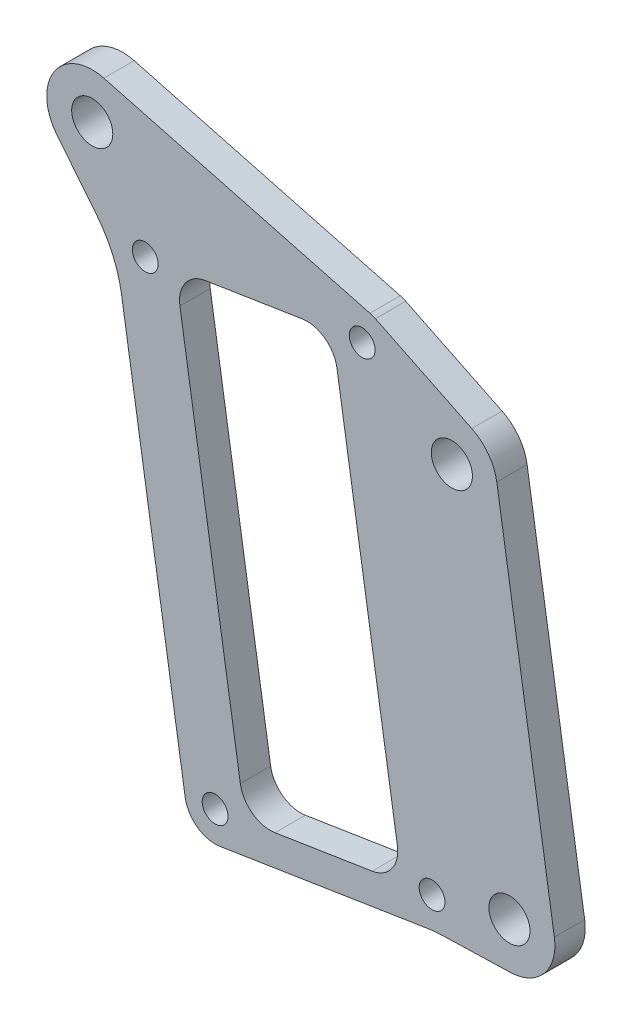
from build123d import *

# Parameters (mm, degrees)
BOSS_EXTRUDE1_DEPTH   = 3.175
FILLET1_R             = 3.175
FILLET2_R             = 12.7
F_2_CLEARANCE_HOLE1_D = 2.7051
F_6_CLEARANCE_HOLE1_D = 4.3053


with BuildPart() as part:
    # Sketch1 → Boss-Extrude1 (new body)
    with BuildSketch(Plane.XY):
        with BuildLine():
            Line((29.084381769, -2.78268505), (1.220294786, 4.603508106))
            ThreePointArc((1.220294786, 4.603508106), (-3.993511378, 2.594855125), (-3.710688281, -2.98533059))
            Line((-3.710688281, -2.98533059), (2.546868459, -10.763310872))
            Line((2.546868459, -10.763310872), (9.732790422, -56.353877547))
            ThreePointArc((9.732790422, -56.353877547), (11.000934269, -58.426775179), (13.363407355, -58.995822037))
            Line((13.363407355, -58.995822037), (35.883167135, -55.446288697))
            Line((35.883167135, -55.446288697), (43.833071408, -55.214709803))
            ThreePointArc((43.833071408, -55.214709803), (47.359348086, -53.495537965), (48.398820761, -49.712724781))
            Line((48.398820761, -49.712724781), (42.367918864, -11.450100102))
            ThreePointArc((42.367918864, -11.450100102), (41.492080159, -9.359050224), (39.748688678, -7.90985418))
            Line((39.748688678, -7.90985418), (29.660979166, -2.997190284))
            ThreePointArc((29.660979166, -2.997190284), (29.377888176, -2.875939169), (29.084381769, -2.78268505))
        make_face()
        Polygon((8.687618809, -8.938372527), (25.134571201, -6.346026675), (32.452304237, -52.772859253), (16.005351845, -55.365205105), align=None, mode=Mode.SUBTRACT)
    extrude(amount=BOSS_EXTRUDE1_DEPTH)

    # Fillet1
    fillet1_edges = [part.edges().sort_by_distance(p)[0] for p in [
        (32.452304237, -52.772859253, 1.5875),
        (25.134571201, -6.346026675, 1.5875),
        (16.005351845, -55.365205105, 1.5875),
        (8.687618809, -8.938372527, 1.5875),
    ]]
    fillet(fillet1_edges, radius=FILLET1_R)

    # Fillet2
    fillet2_edges = [part.edges().sort_by_distance(p)[0] for p in [
        (35.883167135, -55.446288697, 1.5875),
        (2.546868459, -10.763310872, 1.5875),
    ]]
    fillet(fillet2_edges, radius=FILLET2_R)

    # #2 Clearance Hole1 (through all)
    with Locations(Plane.XY.offset(3.175)):
        with Locations((5.551338097, -9.432708748), (28.270851912, -5.851690454), (35.588584948, -52.278523032), (12.869071133, -55.859541326)):
            Hole(F_2_CLEARANCE_HOLE1_D / 2)

    # #6 Clearance Hole1 (through all)
    with Locations(Plane.XY.offset(3.175)):
        with Locations((0, 0), (37.663497797, -12.191604434), (43.694399694, -50.454229113)):
            Hole(F_6_CLEARANCE_HOLE1_D / 2)


solid = part.part
